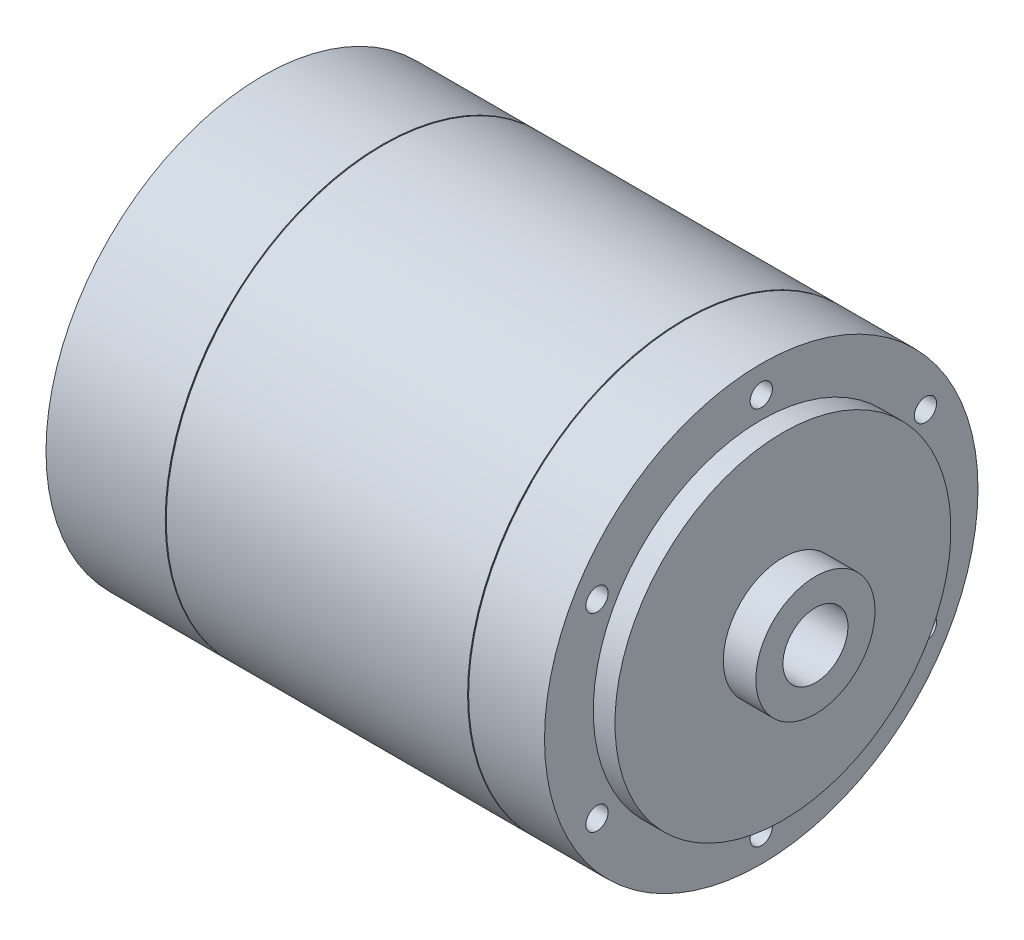
from build123d import *

# Parameters (mm, degrees)
COQUE1_START                 = -46
COQUE1_OUTLINE_R             = 14.9
COQUE1_DEPTH                 = 36
COQUE1_START_2               = -10
COQUE1_2_OUTLINE_R           = 10.5
COQUE1_2_DEPTH               = 2
COQUE1_START_3               = -34.9
COQUE1_3_OUTLINE_R           = 15
COQUE1_3_OUTLINE_R_2         = 14.9
COQUE1_3_DEPTH               = 17.8
COQUE1_START_4               = -47
COQUE1_4_OUTLINE_R           = 7
COQUE1_4_DEPTH               = 1
COQUE1_5_OUTLINE_R           = 15
COQUE1_5_OUTLINE_R_2         = 14.9
COQUE1_5_DEPTH               = 1
COQUE1_START_5               = -8
COQUE1_6_OUTLINE_R           = 0.5
COQUE1_6_DEPTH               = 3
CHANFREIN1_SIZE              = 0.5
ENL_V_MAT_EXTRU_1_REACH      = 62.959
ESQUISSE5_R                  = 3
R_P_TITION_CIRCULAIRE1_COUNT = 8
R_P_TITION_CIRCULAIRE2_COUNT = 6


# Read off the part's stored shape, not the designer's step: Coque1
with BuildPart() as part:
    # Esquisse1 → Base-Révolution (revolve)
    with BuildSketch(Plane.XY, mode=Mode.PRIVATE) as base_r_volution_sk:
        Polygon((-54, 5), (-54, 12), (-51, 12), (-51, 20), (-40, 20), (-40, 19.9), (-39.9, 19.9), (-39.9, 20), (-12.1, 20), (-12.1, 19.9), (-12, 19.9), (-12, 20), (-5, 20), (-5, 15.5), (-3, 15.5), (-3, 5.5), (0, 5.5), (0, 0), (-52, 0), (-52, 5), align=None)
    revolve(base_r_volution_sk.sketch.rotate(Axis((-92, 0, 0), (1, 0, 0)), 180), axis=Axis((-92, 0, 0), (1, 0, 0)))

    # Coque1 outline → Coque1 (cut)
    with BuildSketch(Plane.YZ.offset(COQUE1_START)):
        Circle(COQUE1_OUTLINE_R)
    extrude(amount=COQUE1_DEPTH, mode=Mode.SUBTRACT)

    # Coque1 2 outline → Coque1 2 (cut)
    with BuildSketch(Plane.YZ.offset(COQUE1_START_2)):
        Circle(COQUE1_2_OUTLINE_R)
    extrude(amount=COQUE1_2_DEPTH, mode=Mode.SUBTRACT)

    # Coque1 3 outline → Coque1 3 (cut)
    with BuildSketch(Plane.YZ.offset(COQUE1_START_3)):
        Circle(COQUE1_3_OUTLINE_R)
        Circle(COQUE1_3_OUTLINE_R_2, mode=Mode.SUBTRACT)
    extrude(amount=COQUE1_3_DEPTH, mode=Mode.SUBTRACT)

    # Coque1 4 outline → Coque1 4 (cut)
    with BuildSketch(Plane.YZ.offset(COQUE1_START_4)):
        Circle(COQUE1_4_OUTLINE_R)
    extrude(amount=COQUE1_4_DEPTH, mode=Mode.SUBTRACT)

    # Coque1 5 outline → Coque1 5 (cut)
    with BuildSketch(Plane.YZ.offset(COQUE1_START)):
        Circle(COQUE1_5_OUTLINE_R)
        Circle(COQUE1_5_OUTLINE_R_2, mode=Mode.SUBTRACT)
    extrude(amount=COQUE1_5_DEPTH, mode=Mode.SUBTRACT)

    # Coque1 6 outline → Coque1 6 (cut)
    with BuildSketch(Plane.YZ.offset(COQUE1_START_5)):
        Circle(COQUE1_6_OUTLINE_R)
    extrude(amount=COQUE1_6_DEPTH, mode=Mode.SUBTRACT)

    # Chanfrein1
    chanfrein1_edges = [part.edges().sort_by_distance(p)[0] for p in [
        (-54, 12, 0),
    ]]
    chamfer(chanfrein1_edges, length=CHANFREIN1_SIZE)

    # Esquisse5 → Enlèv. mat.-Extru.1 (cut, up to next)
    with BuildSketch(Plane(origin=(0, 0, 0), x_dir=(0, 0, -1), z_dir=(1, 0, 0)), mode=Mode.PRIVATE) as enl_v_mat_extru_1_sk1:
        with Locations(Location((0, 0, 0), (0, 0, 90))):
            Circle(ESQUISSE5_R)
    enl_v_mat_extru_1_tool1 = extrude(enl_v_mat_extru_1_sk1.sketch, amount=-ENL_V_MAT_EXTRU_1_REACH, mode=Mode.PRIVATE) & part.part
    add(enl_v_mat_extru_1_tool1.solids().sort_by_distance((0, 0, 0))[0], mode=Mode.SUBTRACT)

    # Esquisse4 → Trou taraudé M41 (revolve, cut)
    with BuildSketch(Plane(origin=(-51, 17.5, 0), x_dir=(0, 0, 1), z_dir=(0, 1, 0))):
        Polygon((0, 0), (0, 12.452627944), (1.65, 11.5), (1.65, 0), align=None)
    trou_taraud_m41 = revolve(axis=Axis((-57.35, 17.5, 0), (1, 0, 0)), mode=Mode.SUBTRACT)

    # Esquisse6 → Trou taraudé M2.51 (revolve, cut)
    with BuildSketch(Plane(origin=(-5, 17.5, 0), x_dir=(0, 0, -1), z_dir=(0, 1, 0))):
        Polygon((0, 0), (0, 20.591784026), (1.025, 20), (1.025, 0), align=None)
    trou_taraud_m2_51 = revolve(axis=Axis((1.35, 17.5, 0), (-1, 0, 0)), mode=Mode.SUBTRACT)

    # Répétition circulaire1: Trou taraudé M41 ×8 about axis
    r_p_tition_circulaire1_axis = Axis((0, 0, 0), (1, 0, 0))
    for i in range(1, R_P_TITION_CIRCULAIRE1_COUNT):
        add(trou_taraud_m41.rotate(r_p_tition_circulaire1_axis, i * 360 / R_P_TITION_CIRCULAIRE1_COUNT), mode=Mode.SUBTRACT)

    # Répétition circulaire2: Trou taraudé M2.51 ×6 about axis
    r_p_tition_circulaire2_axis = Axis((0, 0, 0), (1, 0, 0))
    for i in range(1, R_P_TITION_CIRCULAIRE2_COUNT):
        add(trou_taraud_m2_51.rotate(r_p_tition_circulaire2_axis, i * 360 / R_P_TITION_CIRCULAIRE2_COUNT), mode=Mode.SUBTRACT)


solid = part.part
